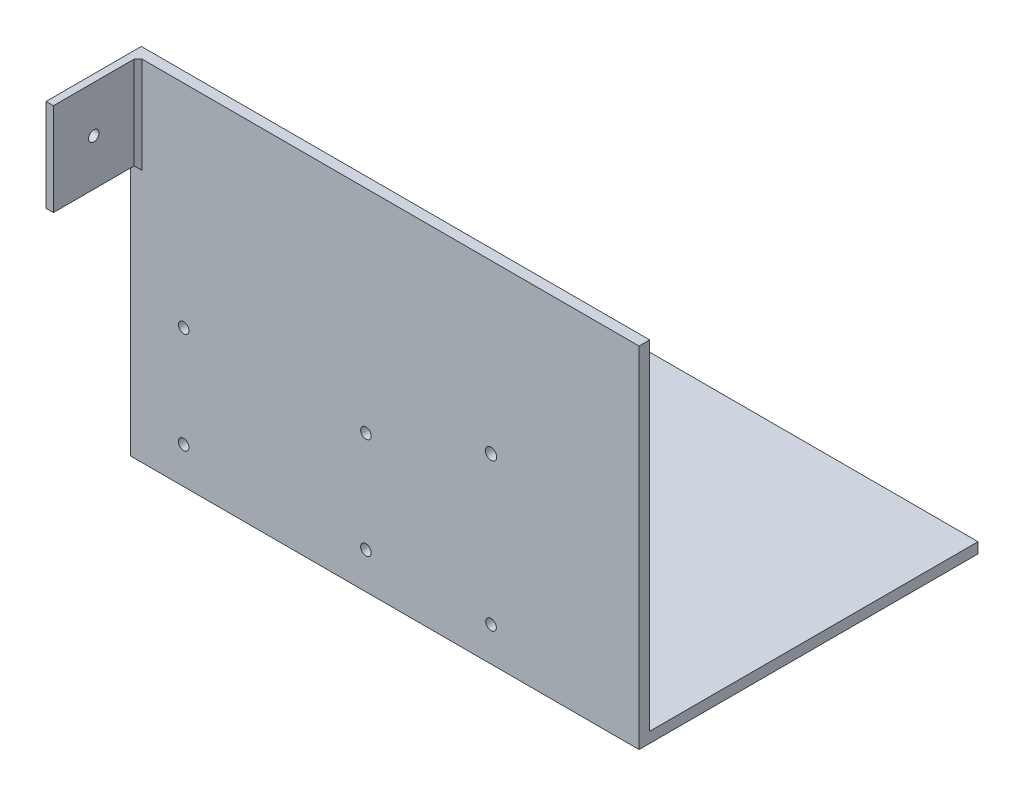
from build123d import *

# Parameters (mm, degrees)
SKETCH1_W           = 304.8
SKETCH1_H           = 203.2
BOSS_EXTRUDE1_DEPTH = 6.35
SKETCH2_W           = 304.8
SKETCH2_H           = 6.35
BOSS_EXTRUDE2_DEPTH = 40.64
SKETCH3_W           = 20.403275231
SKETCH3_H           = 40.64
CUT_EXTRUDE1_DEPTH  = 325.70549749
SKETCH2_2_W         = 304.8
SKETCH2_2_H         = 6.35
BOSS_EXTRUDE3_DEPTH = 203.2
SKETCH9_R           = 3.175
CUT_EXTRUDE2_DEPTH  = 10.922
SKETCH10_R          = 3.392842108
SKETCH10_R_2        = 3.175
CUT_EXTRUDE3_DEPTH  = 10.922
SKETCH11_W          = 4.440800547
SKETCH11_H          = 55.485459727
BOSS_EXTRUDE7_DEPTH = 50.8
CHAMFER1_SIZE       = 2.38
SKETCH12_W          = 5.089607789
SKETCH12_H          = 51.20183316
BOSS_EXTRUDE8_DEPTH = 50.8
CHAMFER2_SIZE       = 2.38
SKETCH13_R          = 3.175
CUT_EXTRUDE4_DEPTH  = 50.8
SKETCH14_R          = 3.175
CUT_EXTRUDE5_DEPTH  = 50.8


with BuildPart() as part:
    # Sketch1 → Boss-Extrude1 (new body)
    with BuildSketch(Plane(origin=(0, 0, 0), x_dir=(1, 0, 0), z_dir=(0, 1, 0))):
        Rectangle(SKETCH1_W, SKETCH1_H)
    extrude(amount=BOSS_EXTRUDE1_DEPTH)

    # Sketch2 → Boss-Extrude2 (add)
    with BuildSketch(Plane(origin=(0, 6.35, 0), x_dir=(1, 0, 0), z_dir=(0, 1, 0))):
        with Locations((0, -98.425)):
            Rectangle(SKETCH2_W, SKETCH2_H)
    extrude(amount=BOSS_EXTRUDE2_DEPTH)

    # Sketch3 → Cut-Extrude1 (cut, through all)
    with BuildSketch(Plane(origin=(152.4, 0, 0), x_dir=(0, 0, -1), z_dir=(1, 0, 0))):
        with Locations((-91.398362385, 26.67)):
            Rectangle(SKETCH3_W, SKETCH3_H)
        with Locations((91.398362385, 26.67)):
            Rectangle(SKETCH3_W, SKETCH3_H)
    extrude(amount=-CUT_EXTRUDE1_DEPTH, mode=Mode.SUBTRACT)

    # Sketch2<2> → Boss-Extrude3 (add)
    with BuildSketch(Plane(origin=(0, 6.35, 0), x_dir=(1, 0, 0), z_dir=(0, 1, 0))):
        with Locations((0, -98.425)):
            Rectangle(SKETCH2_2_W, SKETCH2_2_H)
    extrude(amount=BOSS_EXTRUDE3_DEPTH)

    # Sketch9 → Cut-Extrude2 (cut)
    with BuildSketch(Plane.XZ):
        with Locations((63.625, 73.627514031)):
            Circle(SKETCH9_R)
        with Locations((-11.38, 79.078648077)):
            Circle(SKETCH9_R)
        with Locations((-120.65, 79.078648077)):
            Circle(SKETCH9_R)
        with Locations((-120.65, 18.102975355)):
            Circle(SKETCH9_R)
        with Locations((-11.38, 18.102975355)):
            Circle(SKETCH9_R)
    extrude(amount=-CUT_EXTRUDE2_DEPTH, mode=Mode.SUBTRACT)

    # Sketch10 → Cut-Extrude3 (cut)
    with BuildSketch(Plane.XY.offset(101.6)):
        with Locations((63.625, 109.224080666)):
            Circle(SKETCH10_R)
        with Locations((63.625, 20.555650908)):
            Circle(SKETCH10_R_2)
        with Locations((-120.65, 82.55)):
            Circle(SKETCH10_R_2)
        with Locations((-120.65, 21.89944615)):
            Circle(SKETCH10_R_2)
        with Locations((-11.38, 82.46463474)):
            Circle(SKETCH10_R_2)
        with Locations((-11.38, 21.81408089)):
            Circle(SKETCH10_R_2)
    extrude(amount=-CUT_EXTRUDE3_DEPTH, mode=Mode.SUBTRACT)

    # Sketch11 → Boss-Extrude7 (add)
    with BuildSketch(Plane.XY.offset(101.6)):
        with Locations((-150.179599726, 181.807270136)):
            Rectangle(SKETCH11_W, SKETCH11_H)
    extrude(amount=BOSS_EXTRUDE7_DEPTH)

    # Chamfer1
    chamfer1_edges = [part.edges().sort_by_distance(p)[0] for p in [
        (-147.959199453, 181.807270136, 101.6),
        (-150.179599726, 154.064540273, 101.6),
    ]]
    chamfer(chamfer1_edges, length=CHAMFER1_SIZE)

    # Sketch12 → Boss-Extrude8 (add)
    with BuildSketch(Plane.XZ):
        with Locations((-149.855196105, -75.99908342)):
            Rectangle(SKETCH12_W, SKETCH12_H)
    extrude(amount=BOSS_EXTRUDE8_DEPTH)

    # Chamfer2
    chamfer2_edges = [part.edges().sort_by_distance(p)[0] for p in [
        (-149.855196105, 0, -50.39816684),
        (-147.310392211, 0, -75.99908342),
    ]]
    chamfer(chamfer2_edges, length=CHAMFER2_SIZE)

    # Sketch13 → Cut-Extrude4 (cut)
    with BuildSketch(Plane(origin=(-147.310392211, 0, 0), x_dir=(0, 0, -1), z_dir=(1, 0, 0))):
        with Locations((75.99908342, -26.59)):
            Circle(SKETCH13_R)
    extrude(amount=-CUT_EXTRUDE4_DEPTH, mode=Mode.SUBTRACT)

    # Sketch14 → Cut-Extrude5 (cut)
    with BuildSketch(Plane(origin=(-147.959199453, 0, 0), x_dir=(0, 0, -1), z_dir=(1, 0, 0))):
        with Locations((-128.19, 181.807270136)):
            Circle(SKETCH14_R)
    extrude(amount=-CUT_EXTRUDE5_DEPTH, mode=Mode.SUBTRACT)


solid = part.part
